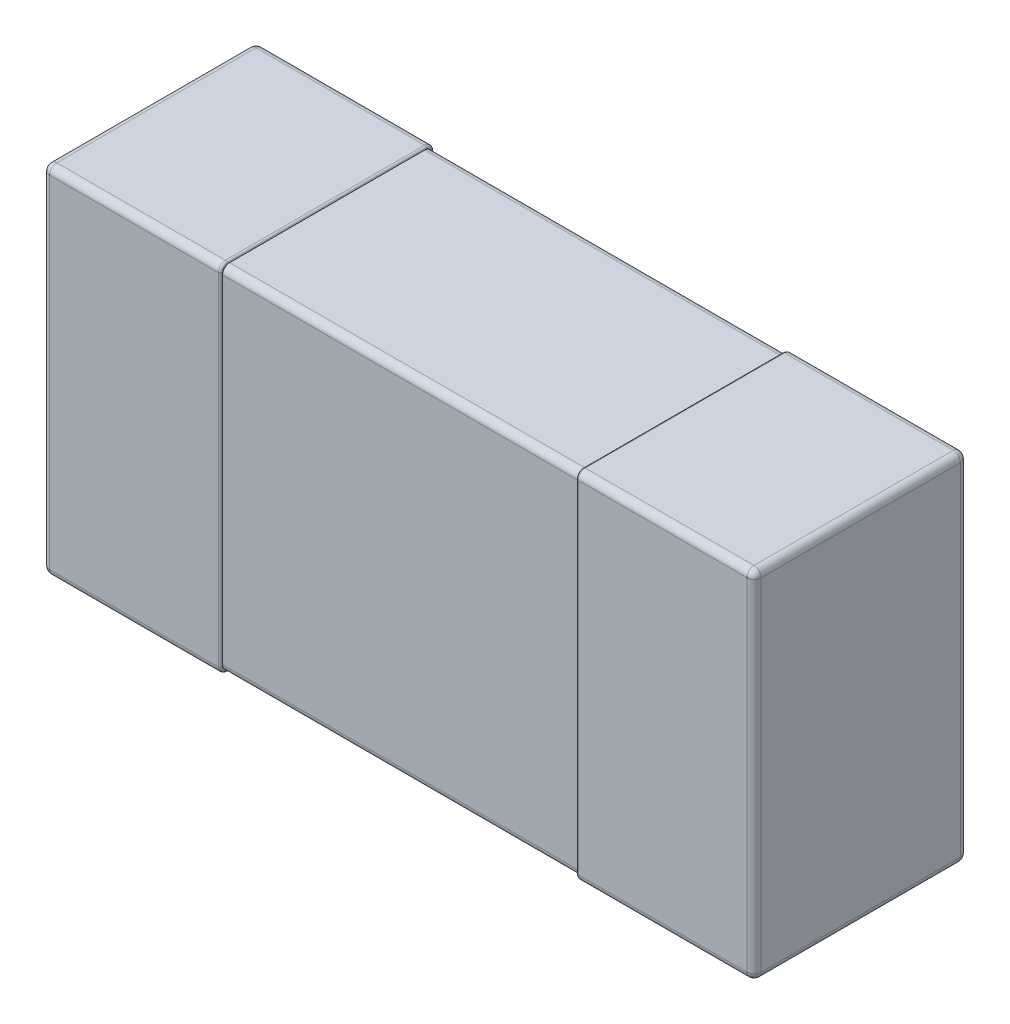
from build123d import *

# Parameters (mm, degrees)
SKETCH1_W                           = 1
SKETCH1_H                           = 0.5
ALL_BODY_DEPTH                      = 0.3
CUT_OUT_THE_BODY_FOR_PIN_DEPTH      = 0.25
CUT_OUT_THE_BODY_FOR_PIN_DEPTH_BACK = 0.25
SKETCH2_OUTSIDE_W                   = 2.532
SKETCH2_OUTSIDE_H                   = 2.732
SKETCH2_OUTSIDE_W_2                 = 0.294
SKETCH2_OUTSIDE_H_2                 = 0.494
BODY_FILLET_R                       = 0.01
PIN_FILLET_A_R                      = 0.01
PIN_FILLET_B_R                      = 0.003


with BuildPart() as part:
    # Sketch1 → All body (new body)
    with BuildSketch(Plane.XY):
        Rectangle(SKETCH1_W, SKETCH1_H)
    extrude(amount=ALL_BODY_DEPTH)

    # Sketch2 outside → Cut out the body for pin (cut, two sides: drawn at the far end of the back side and taken through both)
    with BuildSketch(Plane(origin=(0, 0, 0), x_dir=(0, 0, -1), z_dir=(1, 0, 0)).offset(-CUT_OUT_THE_BODY_FOR_PIN_DEPTH_BACK)):
        with Locations((-0.15, 0)):
            Rectangle(SKETCH2_OUTSIDE_W, SKETCH2_OUTSIDE_H)
        with Locations((-0.15, 0)):
            Rectangle(SKETCH2_OUTSIDE_W_2, SKETCH2_OUTSIDE_H_2, mode=Mode.SUBTRACT)
    extrude(amount=CUT_OUT_THE_BODY_FOR_PIN_DEPTH + CUT_OUT_THE_BODY_FOR_PIN_DEPTH_BACK, mode=Mode.SUBTRACT)

    # Body fillet
    body_fillet_edges = [part.edges().sort_by_distance(p)[0] for p in [
        (0, 0.247, 0.003),
        (0, 0.247, 0.297),
        (0, -0.247, 0.297),
        (0, -0.247, 0.003),
    ]]
    fillet(body_fillet_edges, radius=BODY_FILLET_R)

    # Pin fillet a
    pin_fillet_a_edges = [part.edges().sort_by_distance(p)[0] for p in [
        (0.5, 0, 0.3),
        (-0.375, 0.25, 0),
        (0.375, -0.25, 0),
        (0.375, -0.25, 0.3),
        (-0.375, 0.25, 0.3),
        (0.375, 0.25, 0.3),
        (-0.5, 0, 0.3),
        (0.375, 0.25, 0),
        (0.5, 0, 0),
        (-0.375, -0.25, 0),
        (-0.5, 0, 0),
        (-0.5, 0.25, 0.15),
        (0.5, 0.25, 0.15),
        (0.5, -0.25, 0.15),
        (-0.5, -0.25, 0.15),
        (-0.375, -0.25, 0.3),
    ]]
    fillet(pin_fillet_a_edges, radius=PIN_FILLET_A_R)

    # Pin fillet b
    pin_fillet_b_edges = [part.edges().sort_by_distance(p)[0] for p in [
        (0.25, -0.25, 0.15),
        (0.25, 0, 0.3),
        (0.25, 0.25, 0.15),
        (0.25, 0, 0),
        (-0.25, 0.25, 0.15),
        (-0.25, 0, 0.3),
        (-0.25, -0.25, 0.15),
        (-0.25, 0, 0),
        (0.25, 0.247071068, 0.002928932),
        (0.25, -0.247071068, 0.002928932),
        (0.25, -0.247071068, 0.297071068),
        (0.25, 0.247071068, 0.297071068),
        (-0.25, -0.247071068, 0.297071068),
        (-0.25, 0.247071068, 0.297071068),
        (-0.25, -0.247071068, 0.002928932),
        (-0.25, 0.247071068, 0.002928932),
    ]]
    fillet(pin_fillet_b_edges, radius=PIN_FILLET_B_R - 0.0001)  # a hair under: the kernel refuses the full size


solid = part.part
